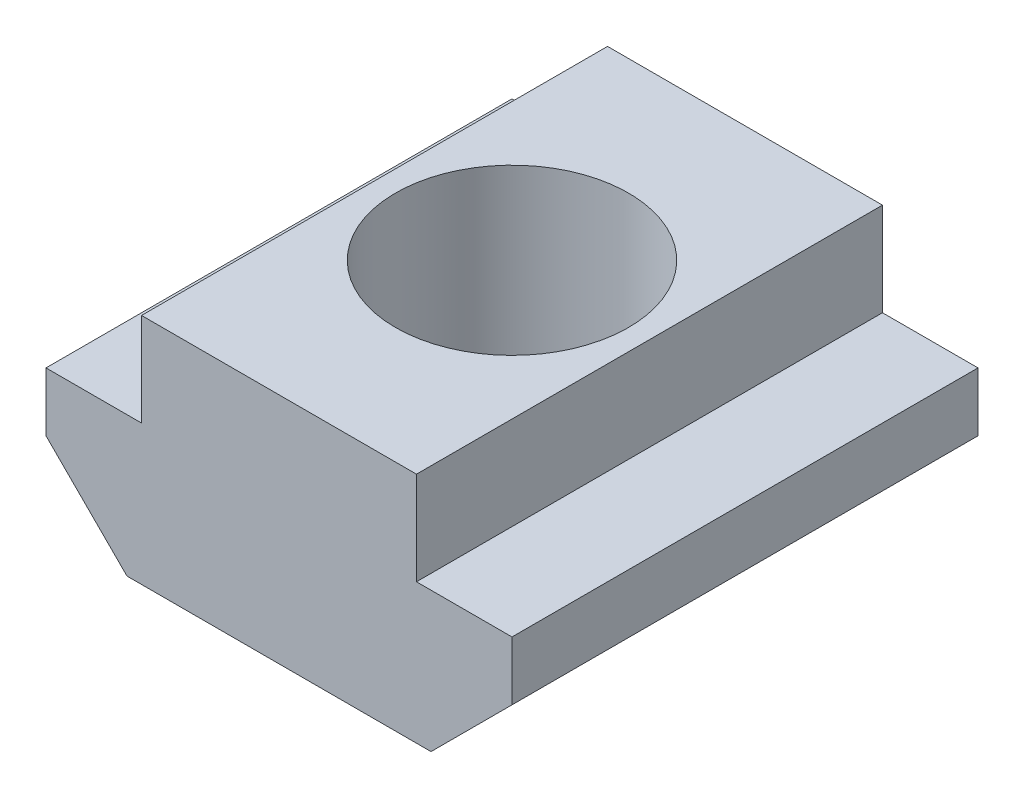
from build123d import *

# Parameters (mm, degrees)
BOSS_EXTRU_1_DEPTH      = 10
ENL_V_MAT_EXTRU_1_REACH = 18.58
ESQUISSE2_R             = 2.5


with BuildPart() as part:
    # Esquisse1 → Boss.-Extru.1 (new body)
    with BuildSketch(Plane.XY):
        Polygon((-10.506087259, -2.086075409), (-3.981368971, -2.086075409), (-2.243728115, -0.348434553), (-2.243728115, 0.913924591), (-4.293728115, 0.913924591), (-4.293728115, 2.913924591), (-10.193728115, 2.913924591), (-10.193728115, 0.913924591), (-12.243728115, 0.913924591), (-12.243728115, -0.348434553), align=None)
    extrude(amount=BOSS_EXTRU_1_DEPTH)

    # Esquisse2 → Enlèv. mat.-Extru.1 (cut, up to next)
    with BuildSketch(Plane(origin=(0, 2.913924591, 0), x_dir=(1, 0, 0), z_dir=(0, 1, 0)), mode=Mode.PRIVATE) as enl_v_mat_extru_1_sk1:
        with Locations((-7.243728115, -5)):
            Circle(ESQUISSE2_R)
    enl_v_mat_extru_1_tool1 = extrude(enl_v_mat_extru_1_sk1.sketch, amount=-ENL_V_MAT_EXTRU_1_REACH, mode=Mode.PRIVATE) & part.part
    add(enl_v_mat_extru_1_tool1.solids().sort_by_distance((-7.243728, 2.913925, 5))[0], mode=Mode.SUBTRACT)


solid = part.part
